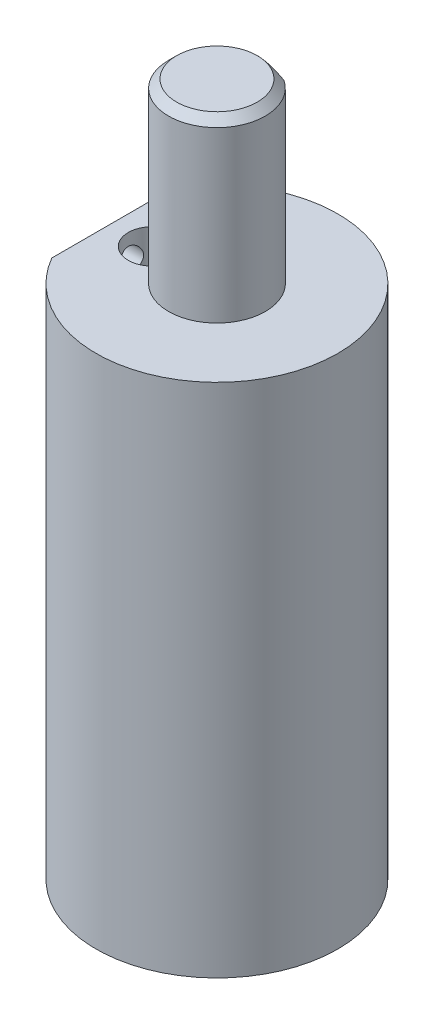
from build123d import *

# Parameters (mm, degrees)
BOSS_EXTRUDE1_DEPTH         = 22
BOSS_EXTRUDE2_DEPTH         = 64
SKETCH3_R                   = 3
CUT_EXTRUDE1_DEPTH          = 65
SKETCH4_R                   = 6
CUT_EXTRUDE2_DEPTH          = 52
M4_TAPPED_HOLE2_D           = 3.3
M4_TAPPED_HOLE2_DEPTH       = 16.8
M4_TAPPED_HOLE2_CSINK_D     = 4
M4_TAPPED_HOLE2_CSINK_ANGLE = 90
M4_TAPPED_HOLE2_TIP         = 0.991420021
SKETCH20_R                  = 2.5
SKETCH20_R_2                = 1.5
CUT_EXTRUDE3_DEPTH          = 5
SKETCH21_R                  = 1
CUT_EXTRUDE4_DEPTH          = 15
BOSS_EXTRUDE4_START         = -22
BOSS_EXTRUDE4_DEPTH         = 22
CUT_EXTRUDE5_DEPTH          = 22
CHAMFER1_SIZE               = 1


with BuildPart() as part:
    # Sketch1 → Boss-Extrude1 (new body)
    with BuildSketch(Plane(origin=(0, 0, 0), x_dir=(1, 0, 0), z_dir=(0, 1, 0))):
        with BuildLine():
            Line((-3.31662479, -5), (3.31662479, -5))
            ThreePointArc((3.31662479, -5), (0, 6), (-3.31662479, -5))
        make_face()
    extrude(amount=BOSS_EXTRUDE1_DEPTH)

    # Sketch2 → Boss-Extrude2 (add)
    with BuildSketch(Plane.XZ):
        with BuildLine():
            Line((-13, 7.483314774), (-13, -7.483314774))
            ThreePointArc((-13, -7.483314774), (15, 0), (-13, 7.483314774))
        make_face()
    extrude(amount=BOSS_EXTRUDE2_DEPTH)

    # Sketch3 → Cut-Extrude1 (cut)
    with BuildSketch(Plane.XZ.offset(64)):
        with Locations(Location((-8, 0, 0), (0, 0, 270))):
            Circle(SKETCH3_R)
    extrude(amount=-CUT_EXTRUDE1_DEPTH, mode=Mode.SUBTRACT)

    # Sketch4 → Cut-Extrude2 (cut)
    with BuildSketch(Plane(origin=(0, -64, 0), x_dir=(-1, 0, 0), z_dir=(0, -1, 0))):
        with Locations(Location((-5, 0, 0), (0, 0, 90))):
            Circle(SKETCH4_R)
    extrude(amount=-CUT_EXTRUDE2_DEPTH, mode=Mode.SUBTRACT)

    # M4 Tapped Hole2
    with Locations(Plane(origin=(0, -64, 0), x_dir=(-1, 0, 0), z_dir=(0, -1, 0))):
        with Locations((0, -9), (0, 9)):
            CounterSinkHole(M4_TAPPED_HOLE2_D / 2, M4_TAPPED_HOLE2_CSINK_D / 2, depth=M4_TAPPED_HOLE2_DEPTH, counter_sink_angle=M4_TAPPED_HOLE2_CSINK_ANGLE)
            with Locations((0, 0, -(M4_TAPPED_HOLE2_DEPTH + M4_TAPPED_HOLE2_TIP / 2))):  # 118° drill point
                Cone(0, M4_TAPPED_HOLE2_D / 2, M4_TAPPED_HOLE2_TIP, mode=Mode.SUBTRACT)

    # Sketch20 → Cut-Extrude3 (cut)
    with BuildSketch(Plane.ZY.offset(13)):
        with Locations((0, -32)):
            Circle(SKETCH20_R)
        with Locations((0, -3)):
            Circle(SKETCH20_R_2)
    extrude(amount=-CUT_EXTRUDE3_DEPTH, mode=Mode.SUBTRACT)

    # Sketch21 → Cut-Extrude4 (cut)
    with BuildSketch(Plane.ZY.offset(13)):
        with Locations((0, -12)):
            Circle(SKETCH21_R)
        with Locations((0, -54)):
            Circle(SKETCH21_R)
    extrude(amount=-CUT_EXTRUDE4_DEPTH, mode=Mode.SUBTRACT)

    # Sketch22 → Boss-Extrude4 (add)
    with BuildSketch(Plane(origin=(0, 22, 0), x_dir=(1, 0, 0), z_dir=(0, 1, 0)).offset(BOSS_EXTRUDE4_START)):
        with BuildLine():
            Line((3.31662479, -5), (-3.31662479, -5))
            ThreePointArc((-3.31662479, -5), (0, -6), (3.31662479, -5))
        make_face()
    extrude(amount=BOSS_EXTRUDE4_DEPTH)

    # Sketch23 → Cut-Extrude5 (cut)
    with BuildSketch(Plane(origin=(0, 22, 0), x_dir=(1, 0, 0), z_dir=(0, 1, 0))):
        Polygon((-67.556784956, 5), (-3.31662479, 5), (3.31662479, 5), (67.556784956, 5), (67.556784956, 133.480320332), (-67.556784956, 133.480320332), align=None)
    extrude(amount=-CUT_EXTRUDE5_DEPTH, mode=Mode.SUBTRACT)

    # Chamfer1
    chamfer1_edges = [part.edges().sort_by_distance(p)[0] for p in [
        (0, 22, 6),
    ]]
    chamfer(chamfer1_edges, length=CHAMFER1_SIZE - 0.0001)  # a hair under: the kernel refuses the full size


solid = part.part
